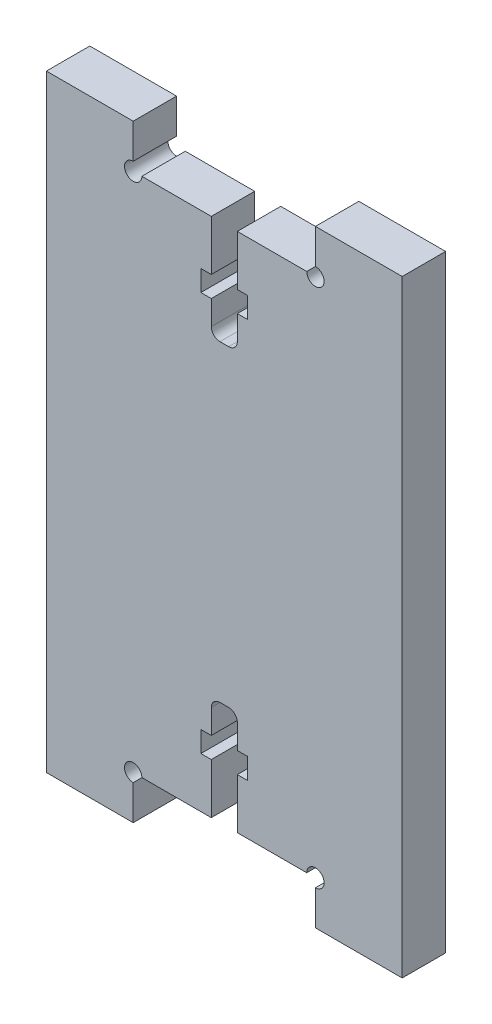
from build123d import *

# Parameters (mm, degrees)
FLANGE_BASE1_DEPTH    = 5
CORTE_EXTRUS_O1_REACH = 55.903
ESBO_O2_R             = 1
QUEBRA_CANTO1_START   = -5
QUEBRA_CANTO1_DEPTH   = 5


# Read off the part's stored shape, not the designer's step: Quebra-Canto1
# Sheet-metal steps are written as plain solids
with BuildPart() as part:
    # Esboço1 → Flange-base1 (new body)
    with BuildSketch(Plane.XY):
        Polygon((-7.191672609, 43.102851176), (1.806254311, 43.102851176), (1.806254311, 37.302851176), (0.606254311, 37.302851176), (0.606254311, 34.902851176), (1.806254311, 34.902851176), (1.806254311, 31.102851176), (4.806254311, 31.102851176), (4.806254311, 34.902851176), (6.006254311, 34.902851176), (6.006254311, 37.302851176), (4.806254311, 37.302851176), (4.806254311, 43.102851176), (13.804181231, 43.102851176), (13.804181231, 48.102851176), (23.804181231, 48.102851176), (23.804181231, -21.897149822), (13.804181231, -21.897149822), (13.804181231, -16.897149822), (4.806254311, -16.897149822), (4.806254311, -11.097149822), (6.006254311, -11.097149822), (6.006254311, -8.697149822), (4.806254311, -8.697149822), (4.806254311, -4.897149822), (1.806254311, -4.897149822), (1.806254311, -8.697149822), (0.606254311, -8.697149822), (0.606254311, -11.097149822), (1.806254311, -11.097149822), (1.806254311, -16.897149822), (-7.191672609, -16.897149822), (-7.191672609, -21.897149822), (-17.191672609, -21.897149822), (-17.191672609, 48.10285125), (-7.191672609, 48.10285125), align=None)
    extrude(amount=-FLANGE_BASE1_DEPTH)

    # Esboço2 → Corte-extrusão1 (cut, up to next)
    with BuildSketch(Plane.XY, mode=Mode.PRIVATE) as corte_extrus_o1_sk1:
        with Locations((-7.191672609, 43.102851176)):
            Circle(ESBO_O2_R)
    corte_extrus_o1_tool1 = extrude(corte_extrus_o1_sk1.sketch, amount=-CORTE_EXTRUS_O1_REACH, mode=Mode.PRIVATE) & part.part
    # Esboço2 → Corte-extrusão1 (cut, up to next)
    with BuildSketch(Plane.XY, mode=Mode.PRIVATE) as corte_extrus_o1_sk2:
        with Locations((13.804181231, 43.102851176)):
            Circle(ESBO_O2_R)
    corte_extrus_o1_tool2 = extrude(corte_extrus_o1_sk2.sketch, amount=-CORTE_EXTRUS_O1_REACH, mode=Mode.PRIVATE) & part.part
    # Esboço2 → Corte-extrusão1 (cut, up to next)
    with BuildSketch(Plane.XY, mode=Mode.PRIVATE) as corte_extrus_o1_sk3:
        with Locations((13.804181231, -16.897149822)):
            Circle(ESBO_O2_R)
    corte_extrus_o1_tool3 = extrude(corte_extrus_o1_sk3.sketch, amount=-CORTE_EXTRUS_O1_REACH, mode=Mode.PRIVATE) & part.part
    # Esboço2 → Corte-extrusão1 (cut, up to next)
    with BuildSketch(Plane.XY, mode=Mode.PRIVATE) as corte_extrus_o1_sk4:
        with Locations((-7.191672609, -16.897149822)):
            Circle(ESBO_O2_R)
    corte_extrus_o1_tool4 = extrude(corte_extrus_o1_sk4.sketch, amount=-CORTE_EXTRUS_O1_REACH, mode=Mode.PRIVATE) & part.part
    add(corte_extrus_o1_tool1.solids().sort_by_distance((-7.191673, 43.102851, 0))[0], mode=Mode.SUBTRACT)
    add(corte_extrus_o1_tool2.solids().sort_by_distance((13.804181, 43.102851, 0))[0], mode=Mode.SUBTRACT)
    add(corte_extrus_o1_tool3.solids().sort_by_distance((13.804181, -16.89715, 0))[0], mode=Mode.SUBTRACT)
    add(corte_extrus_o1_tool4.solids().sort_by_distance((-7.191673, -16.89715, 0))[0], mode=Mode.SUBTRACT)

    # Quebra-Canto1 outline → Quebra-Canto1 (add)
    with BuildSketch(Plane.XY.offset(QUEBRA_CANTO1_START)):
        with BuildLine():
            Line((1.806254311, -4.897149822), (1.806254311, -5.897149822))
            ThreePointArc((1.806254311, -5.897149822), (2.09914753, -5.190043041), (2.806254311, -4.897149822))
            Line((2.806254311, -4.897149822), (1.806254311, -4.897149822))
        make_face()
        with BuildLine():
            Line((4.806254311, -4.897149822), (3.806254311, -4.897149822))
            ThreePointArc((3.806254311, -4.897149822), (4.513361092, -5.190043041), (4.806254311, -5.897149822))
            Line((4.806254311, -5.897149822), (4.806254311, -4.897149822))
        make_face()
        with BuildLine():
            Line((4.806254311, 31.102851176), (4.806254311, 32.102851176))
            ThreePointArc((4.806254311, 32.102851176), (4.513361092, 31.395744395), (3.806254311, 31.102851176))
            Line((3.806254311, 31.102851176), (4.806254311, 31.102851176))
        make_face()
        with BuildLine():
            Line((1.806254311, 31.102851176), (2.806254311, 31.102851176))
            ThreePointArc((2.806254311, 31.102851176), (2.09914753, 31.395744395), (1.806254311, 32.102851176))
            Line((1.806254311, 32.102851176), (1.806254311, 31.102851176))
        make_face()
    extrude(amount=QUEBRA_CANTO1_DEPTH)


solid = part.part
